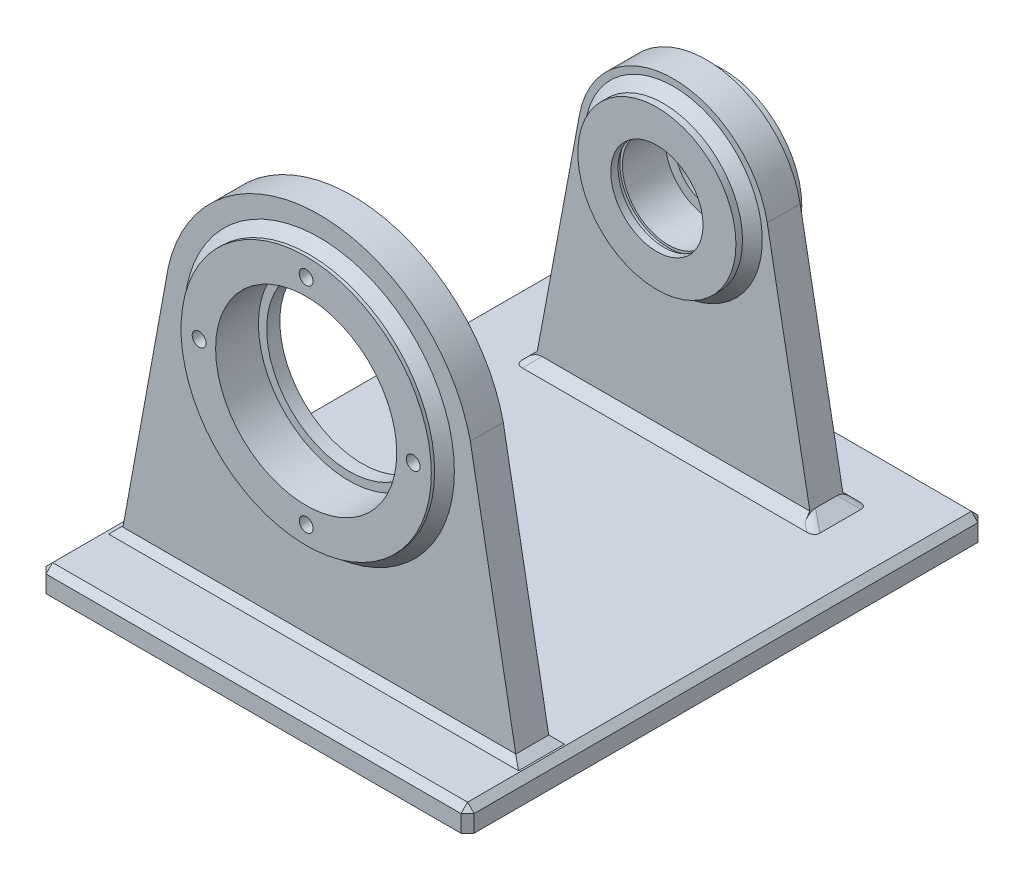
from build123d import *
from OCP.BRepFilletAPI import BRepFilletAPI_MakeChamfer

# Parameters (mm, degrees)
SKETCH1_W           = 130
SKETCH1_H           = 7.184063047
EXTRUDE2_DEPTH      = 157
EXTRUDE3_DEPTH      = 10
EXTRUDE4_DEPTH      = 4
EXTRUDE4_DEPTH_BACK = 13
SKETCH3_R           = 38
SKETCH4_R           = 25
CUT_EXTRUDE1_DEPTH  = 173.073458762
SKETCH5_R           = 27.5
CUT_EXTRUDE2_DEPTH  = 13
CIRPATTERN1_COUNT   = 4
EXTRUDE6_DEPTH      = 10
EXTRUDE7_DEPTH      = 5
EXTRUDE7_DEPTH_BACK = 15
SKETCH11_R          = 24
SKETCH12_R          = 14
CUT_EXTRUDE3_DEPTH  = 35
CHAMFER1_SIZE       = 3
CHAMFER2_SIZE       = 3
CHAMFER3_SIZE       = 2
CHAMFER3_SIZE2      = 2.488491183
CHAMFER3_SIZE2_2    = 2.488422509
CHAMFER4_SIZE       = 3
CHAMFER4_SIZE2      = 3.751681885
SKETCH13_R          = 14.75
CUT_EXTRUDE4_DEPTH  = 1.3
FILLET3_R           = 3
SKETCH14_R          = 17.5
SKETCH14_R_2        = 11
EXTRUDE8_DEPTH      = 3.5
CIRPATTERN2_COUNT   = 4
CHAMFER8_SIZE       = 2


with BuildPart() as part:
    # Sketch1 → Extrude2 (new body)
    with BuildSketch(Plane.XY):
        with Locations((0, -70.592031523)):
            Rectangle(SKETCH1_W, SKETCH1_H)
    extrude(amount=-EXTRUDE2_DEPTH)

    # Sketch2 → Extrude3 (add)
    with BuildSketch(Plane.XY.offset(-20)):
        with BuildLine():
            Line((-60, -67), (-45.86440041, 10.269214916))
            ThreePointArc((-45.86440041, 10.269214916), (-0.018855522, 46.999996218), (45.856146013, 10.30601149))
            Line((45.856146013, 10.30601149), (60, -67))
            Line((60, -67), (-60, -67))
        make_face()
    extrude(amount=-EXTRUDE3_DEPTH)

    # Sketch3 → Extrude4 (add, two sides: drawn at the far end of the back side and taken through both)
    with BuildSketch(Plane.XY.offset(-20).offset(-EXTRUDE4_DEPTH_BACK)):
        Circle(SKETCH3_R)
    extrude(amount=EXTRUDE4_DEPTH + EXTRUDE4_DEPTH_BACK)

    # Sketch4 → Cut-Extrude1 (cut, through all)
    with BuildSketch(Plane.XY.offset(-16)):
        Circle(SKETCH4_R)
    extrude(amount=-CUT_EXTRUDE1_DEPTH, mode=Mode.SUBTRACT)

    # Sketch5 → Cut-Extrude2 (cut)
    with BuildSketch(Plane.XY.offset(-16)):
        Circle(SKETCH5_R)
    extrude(amount=-CUT_EXTRUDE2_DEPTH, mode=Mode.SUBTRACT)

    # Sketch8 → M5 Tapped Hole1 (revolve, cut)
    with BuildSketch(Plane(origin=(-0.013038394, 32.5, -16), x_dir=(0, -1, 0), z_dir=(1, 0, 0))):
        Polygon((0, 0), (0, 15.6618073), (2.1, 14.4), (2.1, 0), align=None)
    m5_tapped_hole1 = revolve(axis=Axis((-0.013038394, 32.5, -9.65), (0, 0, -1)), mode=Mode.SUBTRACT)

    # CirPattern1: M5 Tapped Hole1 ×4 about axis
    cirpattern1_axis = Axis((0, 0, 0), (0, 0, 1))
    for i in range(1, CIRPATTERN1_COUNT):
        add(m5_tapped_hole1.rotate(cirpattern1_axis, i * 360 / CIRPATTERN1_COUNT), mode=Mode.SUBTRACT)

    # Sketch10 → Extrude6 (add)
    with BuildSketch(Plane.XY.offset(-127.5)):
        with BuildLine():
            Line((-42, -67), (-28.508126396, 5.318526994))
            ThreePointArc((-28.508126396, 5.318526994), (0, 29), (28.508126396, 5.318526994))
            Line((28.508126396, 5.318526994), (42, -67))
            Line((42, -67), (-42, -67))
        make_face()
    extrude(amount=-EXTRUDE6_DEPTH)

    # Sketch11 → Extrude7 (add, two sides: drawn at the far end of the back side and taken through both)
    with BuildSketch(Plane.XY.offset(-127.5).offset(-EXTRUDE7_DEPTH_BACK)):
        Circle(SKETCH11_R)
    extrude(amount=EXTRUDE7_DEPTH + EXTRUDE7_DEPTH_BACK)

    # Sketch12 → Cut-Extrude3 (cut)
    with BuildSketch(Plane.XY.offset(-122.5)):
        Circle(SKETCH12_R)
    extrude(amount=-CUT_EXTRUDE3_DEPTH, mode=Mode.SUBTRACT)

    # Chamfer1
    chamfer1_edges = [part.edges().sort_by_distance(p)[0] for p in [
        (-38, 0, -20),
    ]]
    chamfer(chamfer1_edges, length=CHAMFER1_SIZE)

    # Chamfer2
    chamfer2_edges = [part.edges().sort_by_distance(p)[0] for p in [
        (-38, 0, -30),
    ]]
    chamfer(chamfer2_edges, length=CHAMFER2_SIZE - 0.0001)  # a hair under: the kernel refuses the full size

    # Chamfer3: one chamfer whose edges measure the first distance from different faces: ONE call of the kernel's chamfer builder (chamfer() names one face for all edges)
    chamfer3_edges_1 = [part.edges().sort_by_distance(p)[0] for p in [
        (0, -67, -30),
        (0, -67, -20),
    ]]
    chamfer3_edges_2 = [part.edges().sort_by_distance(p)[0] for p in [
        (60, -67, -25),
    ]]
    chamfer3_side_2 = [part.faces().sort_by_distance(p)[0] for p in [
        (52.928073007, -28.346994255, -25),
    ]]
    chamfer3_edges_3 = [part.edges().sort_by_distance(p)[0] for p in [
        (-60, -67, -25),
    ]]
    chamfer3_side_3 = [part.faces().sort_by_distance(p)[0] for p in [
        (0, -67, -79.525585193),
    ]]
    chamfer3 = BRepFilletAPI_MakeChamfer(part.part.solid().wrapped)
    for e in chamfer3_edges_1:
        chamfer3.Add(CHAMFER3_SIZE, e.wrapped)
    for e in chamfer3_edges_2:
        chamfer3.Add(CHAMFER3_SIZE, CHAMFER3_SIZE2, e.wrapped, chamfer3_side_2[0].wrapped)  # the first distance lies on this face
    for e in chamfer3_edges_3:
        chamfer3.Add(CHAMFER3_SIZE, CHAMFER3_SIZE2_2, e.wrapped, chamfer3_side_3[0].wrapped)  # the first distance lies on this face
    add(Compound.cast(chamfer3.Shape()), mode=Mode.REPLACE)

    # Chamfer4: one chamfer whose edges measure the first distance from different faces: ONE call of the kernel's chamfer builder (chamfer() names one face for all edges)
    chamfer4_edges_1 = [part.edges().sort_by_distance(p)[0] for p in [
        (0, -67, -137.5),
        (0, -67, -127.5),
        (-24, 0, -137.5),
        (-24, 0, -127.5),
    ]]
    chamfer4_edges_2 = [part.edges().sort_by_distance(p)[0] for p in [
        (42, -67, -132.5),
    ]]
    chamfer4_side_2 = [part.faces().sort_by_distance(p)[0] for p in [
        (35.254063198, -30.840736503, -132.5),
    ]]
    chamfer4_edges_3 = [part.edges().sort_by_distance(p)[0] for p in [
        (-42, -67, -132.5),
    ]]
    chamfer4_side_3 = [part.faces().sort_by_distance(p)[0] for p in [
        (-0.023878211, -67, -81.18589483),
    ]]
    chamfer4 = BRepFilletAPI_MakeChamfer(part.part.solid().wrapped)
    for e in chamfer4_edges_1:
        chamfer4.Add(CHAMFER4_SIZE, e.wrapped)
    for e in chamfer4_edges_2:
        chamfer4.Add(CHAMFER4_SIZE, CHAMFER4_SIZE2, e.wrapped, chamfer4_side_2[0].wrapped)  # the first distance lies on this face
    for e in chamfer4_edges_3:
        chamfer4.Add(CHAMFER4_SIZE, CHAMFER4_SIZE2, e.wrapped, chamfer4_side_3[0].wrapped)  # the first distance lies on this face
    add(Compound.cast(chamfer4.Shape()), mode=Mode.REPLACE)

    # Sketch13 → Cut-Extrude4 (cut)
    with BuildSketch(Plane.XY.offset(-126)):
        Circle(SKETCH13_R)
    extrude(amount=CUT_EXTRUDE4_DEPTH, mode=Mode.SUBTRACT)

    # Fillet3
    fillet3_edges = [part.edges().sort_by_distance(p)[0] for p in [
        (-43.5, -65.5, -139),
        (-43.5, -65.5, -126),
        (43.600744719, -65.525441738, -139.025441738),
        (43.600744719, -65.525441738, -125.974558262),
    ]]
    fillet(fillet3_edges, radius=FILLET3_R)

    # Sketch14 → Extrude8 (add)
    with BuildSketch(Plane.XY.offset(-139)):
        Circle(SKETCH14_R)
        Circle(SKETCH14_R_2, mode=Mode.SUBTRACT)
    extrude(amount=-EXTRUDE8_DEPTH)

    # Sketch15 → M5 Tapped Hole2 (revolve, cut)
    with BuildSketch(Plane(origin=(0, 18, -142.5), x_dir=(0, 1, 0), z_dir=(1, 0, 0))):
        Polygon((0, 0), (0, 16.2618073), (2.1, 15), (2.1, 0), align=None)
    m5_tapped_hole2 = revolve(axis=Axis((0, 18, -148.85), (0, 0, 1)), mode=Mode.SUBTRACT)

    # CirPattern2: M5 Tapped Hole2 ×4 about axis
    cirpattern2_axis = Axis((0, 0, 0), (0, 0, 1))
    for i in range(1, CIRPATTERN2_COUNT):
        add(m5_tapped_hole2.rotate(cirpattern2_axis, i * 360 / CIRPATTERN2_COUNT), mode=Mode.SUBTRACT)

    # Chamfer8
    chamfer8_edges = [part.edges().sort_by_distance(p)[0] for p in [
        (65, -70.592031524, -157),
        (0, -67, -157),
        (-65, -70.592031524, -157),
        (0, -67, 0),
        (65, -70.592031524, 0),
        (-65, -70.592031524, 0),
        (-65, -67, -78.5),
        (65, -67, -78.5),
    ]]
    chamfer(chamfer8_edges, length=CHAMFER8_SIZE)


solid = part.part
